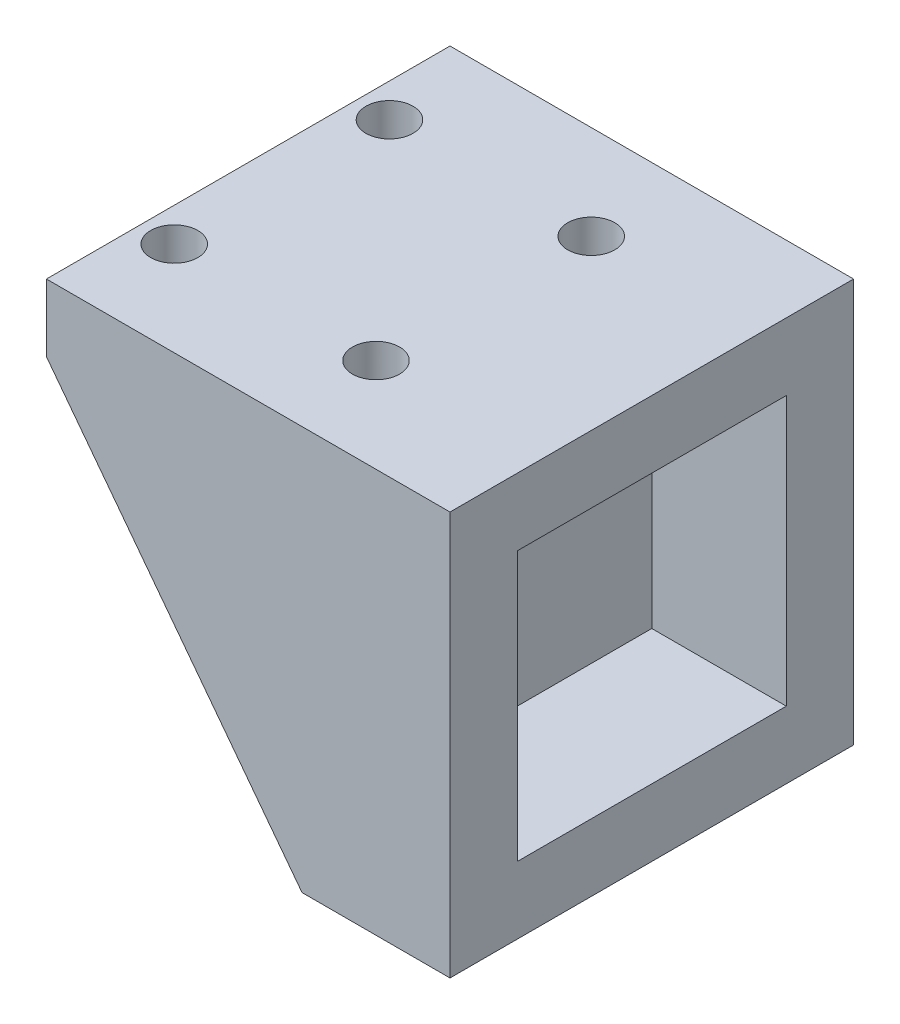
from build123d import *

# Parameters (mm, degrees)
SKETCH1_W           = 30
SKETCH1_H           = 30
SKETCH1_R           = 1.75
BOSS_EXTRUDE1_DEPTH = 5
SKETCH2_W           = 11
SKETCH2_H           = 30
BOSS_EXTRUDE2_DEPTH = 25
SKETCH3_W           = 20
SKETCH3_H           = 20
CUT_EXTRUDE1_DEPTH  = 10
BOSS_EXTRUDE3_DEPTH = 3
BOSS_EXTRUDE4_DEPTH = 3
SKETCH12_R          = 2.9
CUT_EXTRUDE3_DEPTH  = 2
CHAMFER3_SIZE       = 3.732050808
CHAMFER3_SIZE_2     = 1


with BuildPart() as part:
    # Sketch1 → Boss-Extrude1 (new body)
    with BuildSketch(Plane(origin=(0, 0, 0), x_dir=(1, 0, 0), z_dir=(0, 1, 0))):
        with Locations((15, 15)):
            Rectangle(SKETCH1_W, SKETCH1_H)
        with Locations(Location((2.5, 7, 0), (0, 0, 270))):
            Circle(SKETCH1_R, mode=Mode.SUBTRACT)
        with Locations(Location((17.5, 7, 0), (0, 0, 270))):
            Circle(SKETCH1_R, mode=Mode.SUBTRACT)
        with Locations(Location((2.5, 23, 0), (0, 0, 270))):
            Circle(SKETCH1_R, mode=Mode.SUBTRACT)
        with Locations(Location((17.5, 23, 0), (0, 0, 270))):
            Circle(SKETCH1_R, mode=Mode.SUBTRACT)
    extrude(amount=BOSS_EXTRUDE1_DEPTH)

    # Sketch2 → Boss-Extrude2 (add)
    with BuildSketch(Plane.XZ):
        with Locations((24.5, -15)):
            Rectangle(SKETCH2_W, SKETCH2_H)
    extrude(amount=BOSS_EXTRUDE2_DEPTH)

    # Sketch3 → Cut-Extrude1 (cut)
    with BuildSketch(Plane(origin=(30, 0, 0), x_dir=(0, 0, -1), z_dir=(1, 0, 0))):
        with Locations((15, -10)):
            Rectangle(SKETCH3_W, SKETCH3_H)
    extrude(amount=-CUT_EXTRUDE1_DEPTH, mode=Mode.SUBTRACT)

    # Sketch8 → Boss-Extrude3 (add)
    with BuildSketch(Plane(origin=(0, 0, -30), x_dir=(-1, 0, 0), z_dir=(0, 0, -1))):
        Polygon((-19, 0), (0, 0), (-19, -25), align=None)
    extrude(amount=-BOSS_EXTRUDE3_DEPTH)

    # Sketch11 → Boss-Extrude4 (add)
    with BuildSketch(Plane.XY):
        Polygon((19, -25), (0, 0), (19, 0), align=None)
    extrude(amount=-BOSS_EXTRUDE4_DEPTH)

    # Sketch12 → Cut-Extrude3 (cut)
    with BuildSketch(Plane.XZ):
        with Locations(Location((17.5, -23, 0), (0, 0, 270))):
            Circle(SKETCH12_R)
        with Locations(Location((17.5, -7, 0), (0, 0, 270))):
            Circle(SKETCH12_R)
    extrude(amount=-CUT_EXTRUDE3_DEPTH, mode=Mode.SUBTRACT)

    # Chamfer3
    # the kernel refuses this chamfer: 3.732050808, 1 mm, written as the material it takes off along each edge
    with BuildSketch(Plane(origin=(19, 0, -10.826968438), x_dir=(-0.009967146577155864, -0.9999503267608394, 0), z_dir=(0, 0, -1))) as chamfer3_piece_1_section:
        Polygon((CHAMFER3_SIZE * 0.999950326645, -CHAMFER3_SIZE * 0.009967146576), (-CHAMFER3_SIZE_2 * 0.00996714657716, -CHAMFER3_SIZE_2 * 0.999950326761), (0, 0), align=None)
    chamfer3_piece_1 = extrude(amount=24.346063125, mode=Mode.PRIVATE)
    chamfer3_piece_1 = chamfer3_piece_1 & Plane(origin=(17.5, -1.271193321, -23), x_dir=(0, 0, -1), z_dir=(0, -1, 0)) * Cylinder(2.9, 64, mode=Mode.PRIVATE)
    add(chamfer3_piece_1, mode=Mode.SUBTRACT)
    with BuildSketch(Plane(origin=(19, 0, 5.173031562), x_dir=(-0.009967146577155864, -0.9999503267608394, 0), z_dir=(0, 0, -1))) as chamfer3_piece_2_section:
        Polygon((CHAMFER3_SIZE * 0.999950326645, -CHAMFER3_SIZE * 0.009967146576), (-CHAMFER3_SIZE_2 * 0.00996714657716, -CHAMFER3_SIZE_2 * 0.999950326761), (0, 0), align=None)
    chamfer3_piece_2 = extrude(amount=24.346063125, mode=Mode.PRIVATE)
    chamfer3_piece_2 = chamfer3_piece_2 & Plane(origin=(17.5, -1.525075197, -7), x_dir=(0, 0, -1), z_dir=(0, -1, 0)) * Cylinder(2.9, 64, mode=Mode.PRIVATE)
    add(chamfer3_piece_2, mode=Mode.SUBTRACT)


solid = part.part
